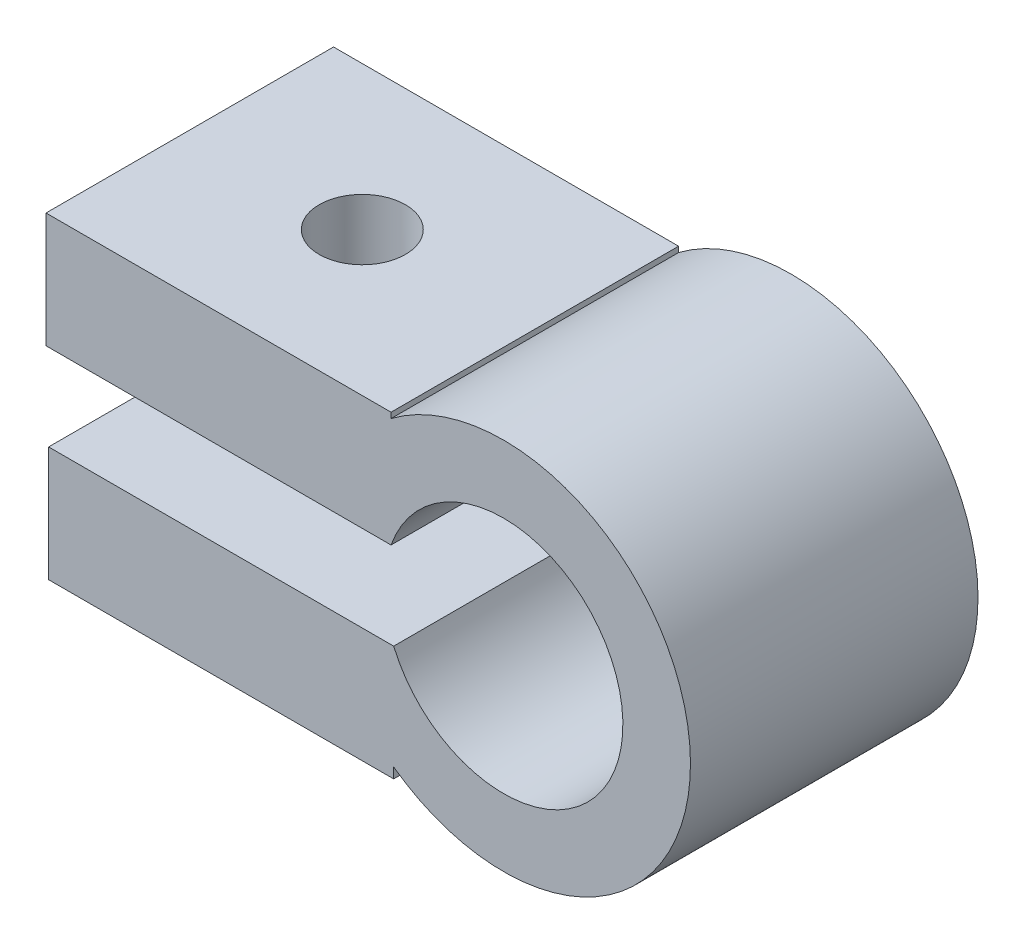
from build123d import *

# Parameters (mm, degrees)
SKETCH1_R           = 6.5
SKETCH1_R_2         = 4.15
BOSS_EXTRUDE1_DEPTH = 10
SKETCH2_W           = 3.218226301
SKETCH2_H           = 3
CUT_EXTRUDE1_DEPTH  = 33
SKETCH3_W           = 12
SKETCH3_H           = 4
BOSS_EXTRUDE2_DEPTH = 10
SKETCH4_R           = 1.5
CUT_EXTRUDE2_DEPTH  = 40
CUT_EXTRUDE3_DEPTH  = 3


with BuildPart() as part:
    # Sketch1 → Boss-Extrude1 (new body)
    with BuildSketch(Plane.XY):
        with Locations((-12.315422017, 2.550703256)):
            Circle(SKETCH1_R)
        with Locations((-12.315422017, 2.550703256)):
            Circle(SKETCH1_R_2, mode=Mode.SUBTRACT)
    extrude(amount=BOSS_EXTRUDE1_DEPTH)

    # Sketch2 → Cut-Extrude1 (cut)
    with BuildSketch(Plane.XY.offset(10)):
        with Locations((-17.357309889, 2.432650589)):
            Rectangle(SKETCH2_W, SKETCH2_H)
    extrude(amount=-CUT_EXTRUDE1_DEPTH, mode=Mode.SUBTRACT)

    # Sketch3 → Boss-Extrude2 (add)
    with BuildSketch(Plane.XY.offset(10)):
        with Locations((-22.136993103, -1.067349411)):
            Rectangle(SKETCH3_W, SKETCH3_H)
        with Locations((-22.228569289, 5.932650589)):
            Rectangle(SKETCH3_W, SKETCH3_H)
    extrude(amount=-BOSS_EXTRUDE2_DEPTH)

    # Sketch4 → Cut-Extrude2 (cut)
    with BuildSketch(Plane(origin=(0, 7.932650589, 0), x_dir=(1, 0, 0), z_dir=(0, 1, 0))):
        with Locations((-22.228569289, -5)):
            Circle(SKETCH4_R)
    extrude(amount=-CUT_EXTRUDE2_DEPTH, mode=Mode.SUBTRACT)

    # Sketch5 → Cut-Extrude3 (cut)
    with BuildSketch(Plane(origin=(0, -3.067349411, 0), x_dir=(-1, 0, 0), z_dir=(0, -1, 0))):
        Polygon((19.051149057, -6.669474185), (22.051149057, -8.401524993), (25.051149057, -6.669474185), (25.051149057, -3.20537257), (22.051149057, -1.473321762), (19.051149057, -3.20537257), align=None)
    extrude(amount=-CUT_EXTRUDE3_DEPTH, mode=Mode.SUBTRACT)


solid = part.part
